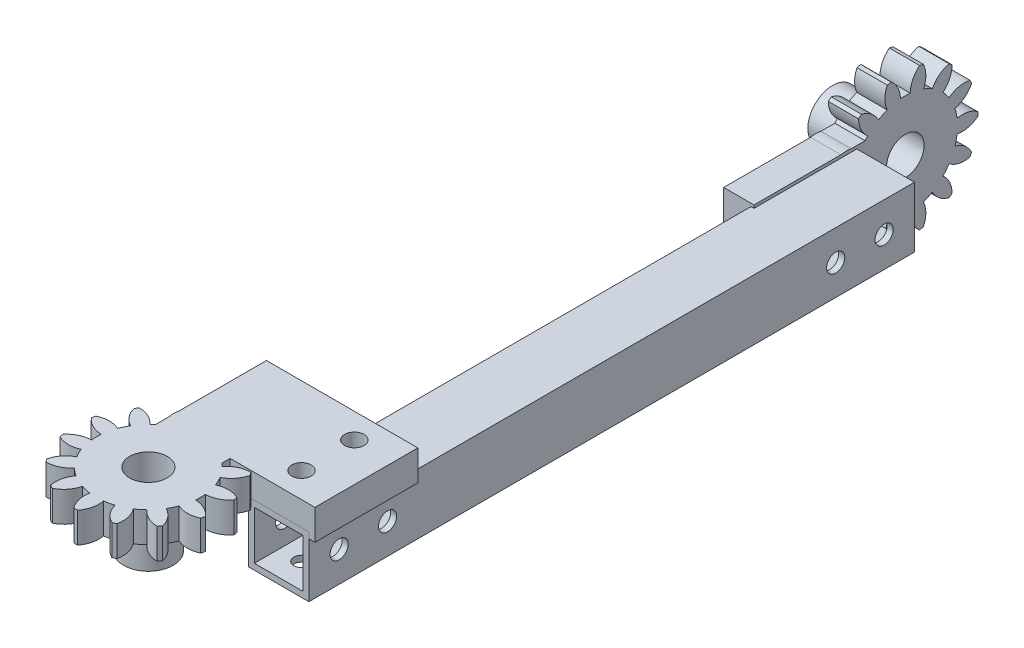
from build123d import *

# Parameters (mm, degrees)
BASPROSKE_W                 = 5
BASPROSKE_H                 = 12
TOOTHCUT_DEPTH              = 18.691806013
TEETHCUTS_COUNT             = 14
TEETHCUTS_ANGLE             = 334.285714286
BORSKE_R                    = 3.1
BORE_DEPTH                  = 50.0000508
SKETCH_2_W                  = 20
SKETCH_2_H                  = 11
EXTRUDE_1_DEPTH             = 5
SKETCH_3_W                  = 17
SKETCH_3_H                  = 10
CUT_EXTRUDE_1_DEPTH         = 0.5
SKETCH_5_W                  = 10
SKETCH_5_H                  = 10
SKETCH_5_W_2                = 8
SKETCH_5_H_2                = 8
EXTRUDE_2_DEPTH             = 100
CUT_EXTRUDE_2_DEPTH         = 110.602402747
CUT_EXTRUDE_2_DEPTH_BACK    = 110.602402747
SKETCH_4_R                  = 1.25
SKETCH_7_R                  = 4.1
SKETCH_7_R_2                = 3.1
EXTRUDE_3_DEPTH             = 7
SKETCH_6_R                  = 1.5
CUT_EXTRUDE_3_DEPTH         = 130.053038274
MOVE_BODY_1_ANGLE           = 90
SKETCH_8_W                  = 10
SKETCH_8_H                  = 17
EXTRUDE_4_DEPTH             = 5
SKETCH_12_W                 = 25
SKETCH_12_H                 = 17
EXTRUDE_7_DEPTH             = 5
OTHER_START                 = 4.5
OTHER_4_OUTLINE_W           = 1
OTHER_4_OUTLINE_H           = 17
OTHER_4_DEPTH               = 10
HOLE_WIZARD_M3_1_AT_2_COUNT = 2
HOLE_WIZARD_M3_1_AT_2_PITCH = 8.739122398


with BuildPart() as part:
    # BasProSke → Base-Revolve (revolve)
    with BuildSketch(Plane(origin=(0, 0, 0), x_dir=(1, 0, 0), z_dir=(0, 1, 0)), mode=Mode.PRIVATE) as base_revolve_sk:
        with Locations((2.5, 6)):
            Rectangle(BASPROSKE_W, BASPROSKE_H)
    revolve(base_revolve_sk.sketch.rotate(Axis((-10, 0, 0), (1, 0, 0)), 180), axis=Axis((-10, 0, 0), (1, 0, 0)))

    # TooCutSke → ToothCut (cut, through all)
    with BuildSketch(Plane(origin=(0, 0, 0), x_dir=(0, 0, -1), z_dir=(1, 0, 0))):
        with BuildLine():
            ThreePointArc((0.804845511, 8.586361261), (0, 8.624), (-0.804845511, 8.586361261))
            ThreePointArc((-0.804845511, 8.586361261), (-1.237812142, 10.362618414), (-2.384428228, 11.78663426))
            ThreePointArc((-2.384428228, 11.78663426), (0, 12.0254), (2.384428228, 11.78663426))
            ThreePointArc((2.384428228, 11.78663426), (1.237812142, 10.362618414), (0.804845511, 8.586361261))
        make_face()
    toothcut = extrude(amount=TOOTHCUT_DEPTH, mode=Mode.SUBTRACT)

    # TeethCuts: ToothCut ×14 about axis
    teethcuts_axis = Axis((-10, 0, 0), (1, 0, 0))
    for i in range(1, TEETHCUTS_COUNT):
        add(toothcut.rotate(teethcuts_axis, i * TEETHCUTS_ANGLE / (TEETHCUTS_COUNT - 1)), mode=Mode.SUBTRACT)

    # BorSke → Bore (cut, symmetric)
    with BuildSketch(Plane(origin=(0, 0, 0), x_dir=(0, 0, -1), z_dir=(1, 0, 0))):
        with Locations(Location((0, 0, 0), (0, 0, 180))):
            Circle(BORSKE_R)
    extrude(amount=BORE_DEPTH, both=True, mode=Mode.SUBTRACT)

    # ｽｹｯﾁ2 → ﾎﾞｽ - 押し出し1 (add)
    with BuildSketch(Plane(origin=(5, 0, 0), x_dir=(0, 0, -1), z_dir=(1, 0, 0))):
        with Locations((15, 0)):
            Rectangle(SKETCH_2_W, SKETCH_2_H)
    extrude(amount=-EXTRUDE_1_DEPTH)

    # ｽｹｯﾁ3 → ｶｯﾄ - 押し出し1 (cut)
    with BuildSketch(Plane(origin=(5, 0, 0), x_dir=(0, 0, -1), z_dir=(1, 0, 0))):
        with Locations((16.5, 0)):
            Rectangle(SKETCH_3_W, SKETCH_3_H)
    extrude(amount=-CUT_EXTRUDE_1_DEPTH, mode=Mode.SUBTRACT)

    # ｽｹｯﾁ4 → ｶｯﾄ - 押し出し2 (cut, two sides: drawn at the far end of the back side and taken through both)
    with BuildSketch(Plane.ZY.offset(-CUT_EXTRUDE_2_DEPTH_BACK)):
        with Locations(Location((-21, 0, 0), (0, 0, 180))):
            Circle(SKETCH_4_R)
        with Locations(Location((-13, 0, 0), (0, 0, 180))):
            Circle(SKETCH_4_R)
    extrude(amount=CUT_EXTRUDE_2_DEPTH + CUT_EXTRUDE_2_DEPTH_BACK, mode=Mode.SUBTRACT)

    # ｽｹｯﾁ7 → ﾎﾞｽ - 押し出し3 (add)
    with BuildSketch(Plane.ZY):
        with Locations(Location((0, 0, 0), (0, 0, 180))):
            Circle(SKETCH_7_R)
        Circle(SKETCH_7_R_2, mode=Mode.SUBTRACT)
    extrude(amount=EXTRUDE_3_DEPTH)


with BuildPart() as body_2:
    # ｽｹｯﾁ5 → ﾎﾞｽ - 押し出し2 (new body)
    with BuildSketch(Plane(origin=(0, 0, -8), x_dir=(-1, 0, 0), z_dir=(0, 0, -1))):
        with Locations((-9.5, 0)):
            Rectangle(SKETCH_5_W, SKETCH_5_H)
        with Locations((-9.5, 0)):
            Rectangle(SKETCH_5_W_2, SKETCH_5_H_2, mode=Mode.SUBTRACT)
    extrude(amount=EXTRUDE_2_DEPTH)

    # ｽｹｯﾁ6 → ｶｯﾄ - 押し出し3 (cut, through all)
    with BuildSketch(Plane.ZY.offset(-4.5)):
        with Locations((-103, 0)):
            Circle(SKETCH_6_R)
        with Locations((-95, 0)):
            Circle(SKETCH_6_R)
        with Locations((-21, 0)):
            Circle(SKETCH_6_R)
        with Locations((-13, 0)):
            Circle(SKETCH_6_R)
    extrude(amount=-CUT_EXTRUDE_3_DEPTH, mode=Mode.SUBTRACT)


with BuildPart() as body_3:
    # ﾐﾗｰ2: mirrored copy
    add(part.part.mirror(Plane(origin=(0, 0, -58), x_dir=(1, 0, 0), z_dir=(0, 0, -1))))


with BuildPart() as part_1:
    # Move Body 1: read off the stored shape, not the designer's step
    # Move Body 1: moved
    add(part.part.moved(Location((4, 4, 0))).rotate(Axis((0, 0, 0), (0, 0, 1)), MOVE_BODY_1_ANGLE))

    # ｽｹｯﾁ8 → ﾎﾞｽ - 押し出し4 (add)
    with BuildSketch(Plane(origin=(0, 9, 0), x_dir=(1, 0, 0), z_dir=(0, 1, 0))):
        with Locations((-4, 16.5)):
            Rectangle(SKETCH_8_W, SKETCH_8_H)
    extrude(amount=-EXTRUDE_4_DEPTH)

    # ｽｹｯﾁ12 → ﾎﾞｽ - 押し出し7 (add)
    with BuildSketch(Plane.XZ.offset(-4)):
        with Locations((3, -16.5)):
            Rectangle(SKETCH_12_W, SKETCH_12_H)
    extrude(amount=-EXTRUDE_7_DEPTH)

    # ｲﾝﾃﾞﾝﾄ4: read off the stored shape, not the designer's step
    # ｲﾝﾃﾞﾝﾄ4 outline → ｲﾝﾃﾞﾝﾄ4 (cut)
    with BuildSketch(Plane.YZ.offset(OTHER_START)):
        with Locations((4.5, -16.5)):
            Rectangle(OTHER_4_OUTLINE_W, OTHER_4_OUTLINE_H)
    extrude(amount=OTHER_4_DEPTH, mode=Mode.SUBTRACT)


with BuildPart() as hole_wizard_m3_1_tool:
    # ｽｹｯﾁ16 → M3 穴付きねじ用座ぐり穴1 (revolve)
    with BuildSketch(Plane(origin=(9.116161615, 9, -12.156429836), x_dir=(0, 0, 1), z_dir=(1, 0, 0))):
        Polygon((0, 0), (0, 20.765912111), (1.25, 20.765912111), (1.25, 4), (1.6, 4), (1.6, 0), align=None)
    hole_wizard_m3_1 = revolve(axis=Axis((9.116161615, 15.35, -12.156429836), (0, -1, 0)))


with BuildPart() as part_2:
    add(part_1.part)

    # M3 穴付きねじ用座ぐり穴1: cut by hole_wizard_m3_1_tool
    add(hole_wizard_m3_1_tool.part, mode=Mode.SUBTRACT)


with BuildPart() as body_2_1:
    add(body_2.part)

    # M3 穴付きねじ用座ぐり穴1: cut by hole_wizard_m3_1_tool
    add(hole_wizard_m3_1_tool.part, mode=Mode.SUBTRACT)


with BuildPart() as hole_wizard_m3_1_at_2_tool:
    # M3 穴付きねじ用座ぐり穴1 at 2: M3 穴付きねじ用座ぐり穴1 ×2
    with Locations(*[(0, 0, -i * HOLE_WIZARD_M3_1_AT_2_PITCH) for i in range(1, HOLE_WIZARD_M3_1_AT_2_COUNT)]):
        add(hole_wizard_m3_1)


with BuildPart() as part_3:
    add(part_2.part)

    # M3 穴付きねじ用座ぐり穴1 at 2: cut by hole_wizard_m3_1_at_2_tool
    add(hole_wizard_m3_1_at_2_tool.part, mode=Mode.SUBTRACT)


with BuildPart() as body_2_2:
    add(body_2_1.part)

    # M3 穴付きねじ用座ぐり穴1 at 2: cut by hole_wizard_m3_1_at_2_tool
    add(hole_wizard_m3_1_at_2_tool.part, mode=Mode.SUBTRACT)


solid = Compound([body_3.part, part_3.part, body_2_2.part])
